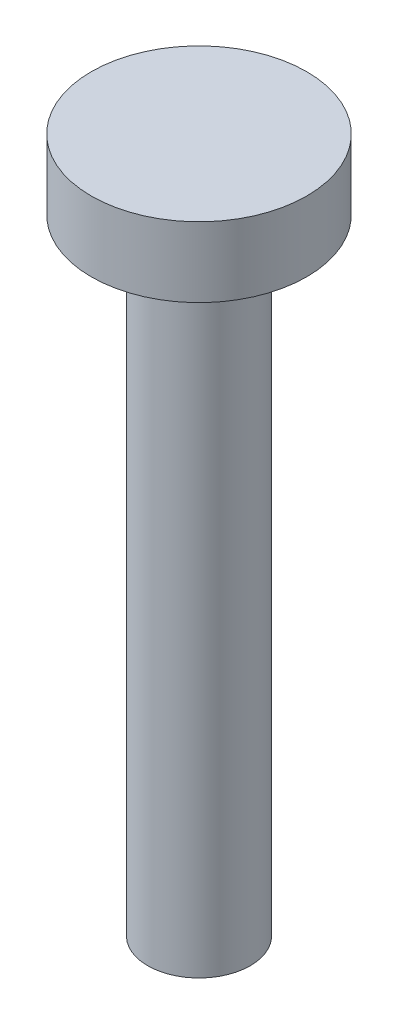
from build123d import *

# Parameters (mm, degrees)
REVOLVE1_ANGLE = 359.999695921


with BuildPart() as part:
    # Sketch1 → Revolve1 (revolve)
    with BuildSketch(Plane.XY):
        Polygon((0, 0), (4.7625, 0), (4.7625, 58), (10, 58), (10, 64.5), (0, 64.5), align=None)
    revolve(axis=Axis((0, 0, 0), (0, 1, 0)), revolution_arc=REVOLVE1_ANGLE)


solid = part.part
